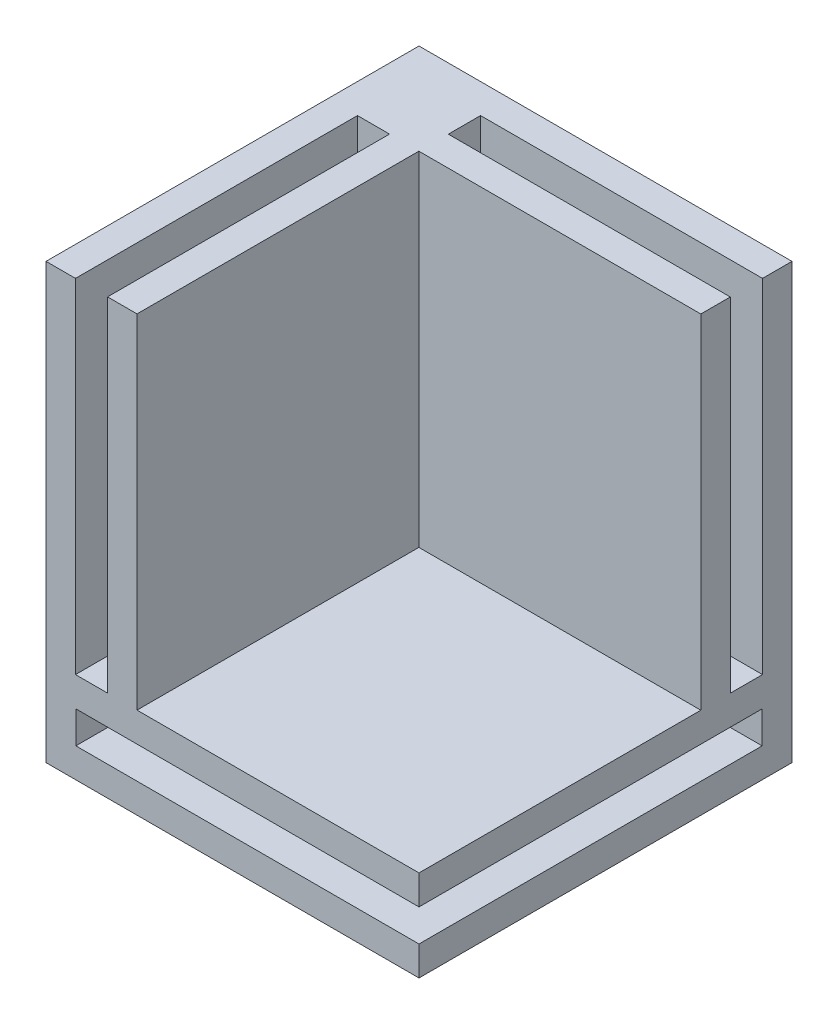
from build123d import *

# Parameters (mm, degrees)
SKETCH1_W           = 50
SKETCH1_H           = 12.2
BOSS_EXTRUDE1_DEPTH = 50
SKETCH2_W           = 46
SKETCH2_H           = 4.3
CUT_EXTRUDE1_DEPTH  = 46
SKETCH3_W           = 50
SKETCH3_H           = 50
BOSS_EXTRUDE2_DEPTH = 46
SKETCH4_W           = 37.8
SKETCH4_H           = 37.78
CUT_EXTRUDE2_DEPTH  = 46
SKETCH6_W           = 4.32
SKETCH6_H           = 46
CUT_EXTRUDE3_DEPTH  = 37.8
SKETCH9_W           = 4.3
SKETCH9_H           = 46
CUT_EXTRUDE4_DEPTH  = 37.8


with BuildPart() as part:
    # Sketch1 → Boss-Extrude1 (new body)
    with BuildSketch(Plane.XY):
        with Locations((-16.249929658, 18.197752809)):
            Rectangle(SKETCH1_W, SKETCH1_H)
    extrude(amount=BOSS_EXTRUDE1_DEPTH)

    # Sketch2 → Cut-Extrude1 (cut)
    with BuildSketch(Plane(origin=(8.750070342, 0, 0), x_dir=(0, 0, -1), z_dir=(1, 0, 0))):
        with Locations((-27, 18.197752809)):
            Rectangle(SKETCH2_W, SKETCH2_H)
    extrude(amount=-CUT_EXTRUDE1_DEPTH, mode=Mode.SUBTRACT)

    # Sketch3 → Boss-Extrude2 (add)
    with BuildSketch(Plane(origin=(0, 24.297752809, 0), x_dir=(1, 0, 0), z_dir=(0, 1, 0))):
        with Locations((-16.249929658, -25)):
            Rectangle(SKETCH3_W, SKETCH3_H)
    extrude(amount=BOSS_EXTRUDE2_DEPTH)

    # Sketch4 → Cut-Extrude2 (cut)
    with BuildSketch(Plane(origin=(0, 70.297752809, 0), x_dir=(1, 0, 0), z_dir=(0, 1, 0))):
        with Locations((-10.149929658, -31.11)):
            Rectangle(SKETCH4_W, SKETCH4_H)
    extrude(amount=-CUT_EXTRUDE2_DEPTH, mode=Mode.SUBTRACT)

    # Sketch6 → Cut-Extrude3 (cut)
    with BuildSketch(Plane(origin=(8.750070342, 0, 0), x_dir=(0, 0, -1), z_dir=(1, 0, 0))):
        with Locations((-6.11, 47.297752809)):
            Rectangle(SKETCH6_W, SKETCH6_H)
    extrude(amount=-CUT_EXTRUDE3_DEPTH, mode=Mode.SUBTRACT)

    # Sketch9 → Cut-Extrude4 (cut)
    with BuildSketch(Plane.XY.offset(50)):
        with Locations((-35.149929658, 47.297752809)):
            Rectangle(SKETCH9_W, SKETCH9_H)
    extrude(amount=-CUT_EXTRUDE4_DEPTH, mode=Mode.SUBTRACT)


solid = part.part
